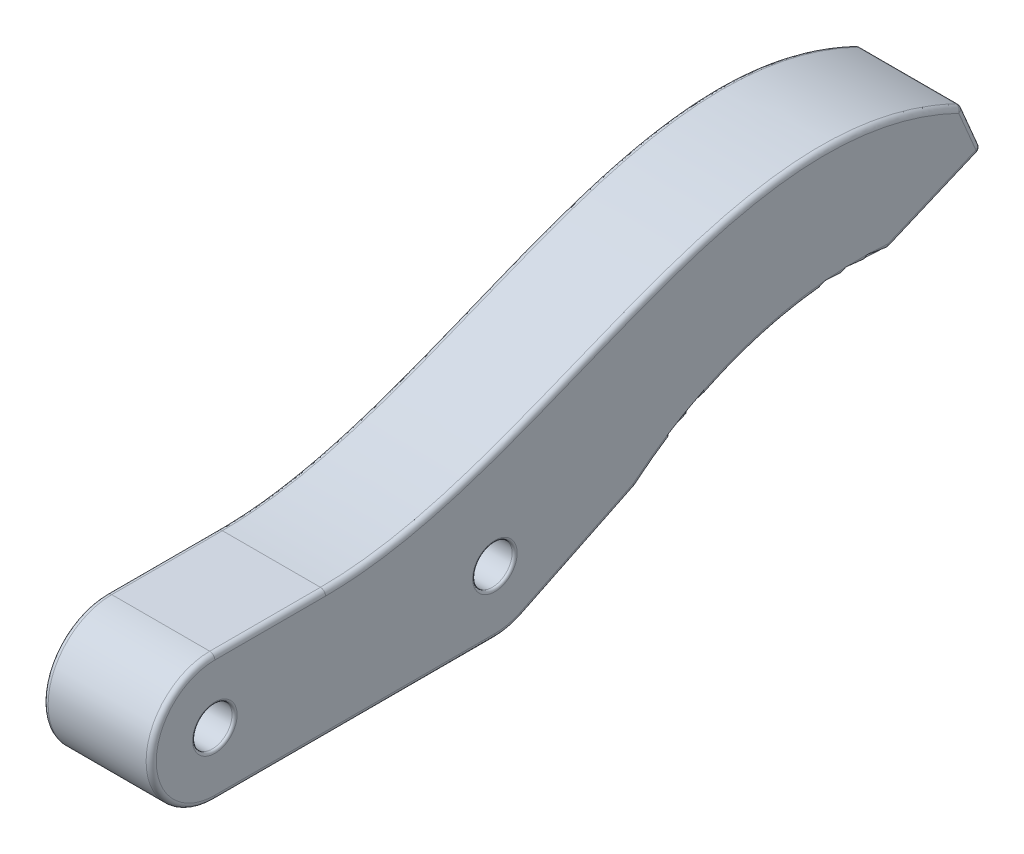
from build123d import *

# Parameters (mm, degrees)
SKETCH_1_R            = 1.75
EXTRUDE_1_DEPTH       = 8.5
EXTRUDE_2_OUTLINE_R   = 1.75
EXTRUDE_2_OUTLINE_R_2 = 1.55
EXTRUDE_2_DEPTH       = 8.5
FILLET_1_R            = 0.4
FILLET_2_R            = 0.2


# Read off the part's stored shape, not the designer's step: 凸台-拉伸2
with BuildPart() as part:
    # 草图1 → 凸台-拉伸1 (new body)
    with BuildSketch(Plane(origin=(8.5, 0, 0), x_dir=(0, 0, -1), z_dir=(1, 0, 0))):
        with BuildLine():
            Line((13.694974759, 10), (5, 10))
            ThreePointArc((5, 10), (0, 5), (5, 0))
            Line((5, 0), (27, 0))
            ThreePointArc((27, 0), (28.120410255, 0.12714859), (29.183837075, 0.502127655))
            Line((29.183837075, 0.502127655), (38.08542066, 4.824084077))
            ThreePointArc((38.08542066, 4.824084077), (47.396990541, 9.917410338), (57.948000409, 11.067843667))
            Line((57.948000409, 11.067843667), (65.313809691, 14.189518476))
            Line((65.313809691, 14.189518476), (63.752972286, 17.872423117))
            add(Edge.make_bspline(
                [(63.752972286, 17.872423117), (45.928882678, 26.563787963), (31.059268621, 10), (13.694974759, 10)],
                knots=[0, 0, 0, 0, 1, 1, 1, 1], degree=3))
        make_face()
        with Locations(Location((5, 5, 0), (0, 0, 180))):
            Circle(SKETCH_1_R, mode=Mode.SUBTRACT)
        with Locations(Location((27, 5, 0), (0, 0, 180))):
            Circle(SKETCH_1_R, mode=Mode.SUBTRACT)
    extrude(amount=-EXTRUDE_1_DEPTH)

    # 凸台-拉伸2 outline → 凸台-拉伸2 (add)
    # profile 1 of 2: a face of its own
    with BuildSketch(Plane.YZ):
        with Locations((5, -5)):
            Circle(EXTRUDE_2_OUTLINE_R)
        with Locations((5, -5)):
            Circle(EXTRUDE_2_OUTLINE_R_2, mode=Mode.SUBTRACT)
    # profile 2 of 2: a face of its own
    with BuildSketch(Plane.YZ):
        with Locations((5, -27)):
            Circle(EXTRUDE_2_OUTLINE_R)
        with Locations((5, -27)):
            Circle(EXTRUDE_2_OUTLINE_R_2, mode=Mode.SUBTRACT)
    extrude(amount=EXTRUDE_2_DEPTH)

    # 圆角1
    fillet_1_edges = [part.edges().sort_by_distance(p)[0] for p in [
        (8.5, 9.917410338, -47.396990541),
        (8.5, 2.663105866, -33.634628868),
        (8.5, 0.12714859, -28.120410255),
        (8.5, 0, -16),
        (8.5, 5, 0),
        (8.5, 10, -9.347487379),
        (8.5, 17.192155422, -38.542735392),
        (0, 5, 0),
        (4.25, 17.872423117, -63.752972286),
        (4.25, 14.189518476, -65.313809691),
        (4.25, 11.067843667, -57.948000409),
        (4.25, 4.824084077, -38.08542066),
        (0, 0, -16),
        (0, 0.12714859, -28.120410255),
        (0, 2.663105866, -33.634628868),
        (0, 9.917410338, -47.396990541),
        (0, 12.628681071, -61.63090505),
        (0, 16.030970797, -64.533390989),
        (0, 17.192155422, -38.542735392),
        (0, 10, -9.347487379),
        (8.5, 16.030970797, -64.533390989),
        (8.5, 12.628681071, -61.63090505),
    ]]
    fillet(fillet_1_edges, radius=FILLET_1_R)

    # 圆角2
    fillet_2_edges = [part.edges().sort_by_distance(p)[0] for p in [
        (0, 3.45, -27),
        (8.5, 3.45, -27),
        (0, 3.45, -5),
        (8.5, 3.45, -5),
    ]]
    fillet(fillet_2_edges, radius=FILLET_2_R)


solid = part.part
